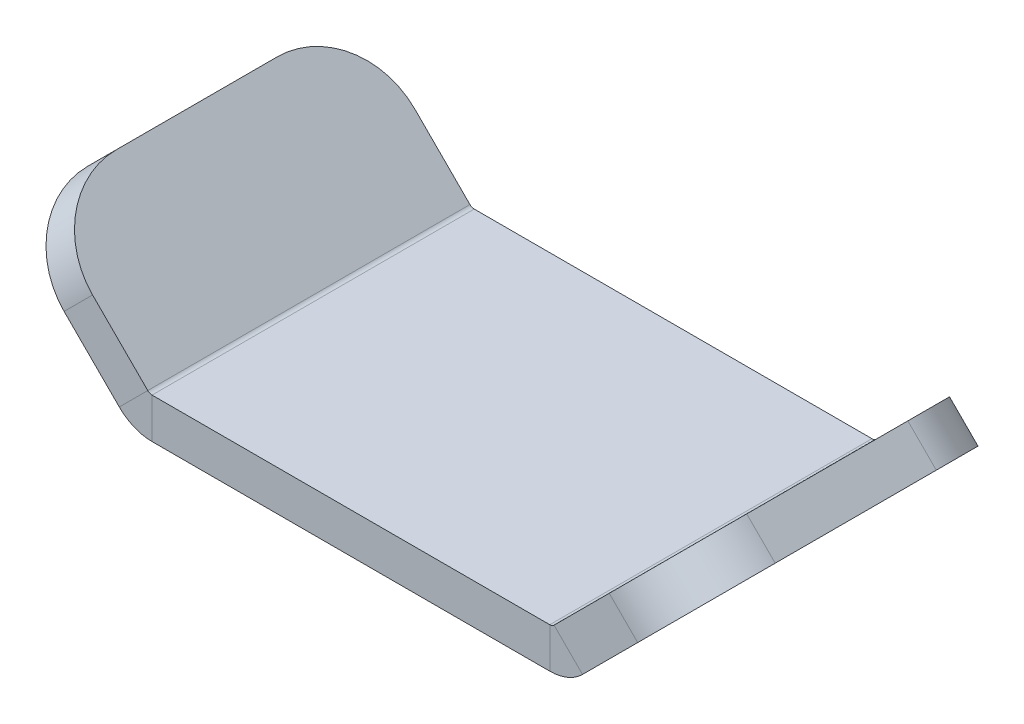
from build123d import *

# Parameters (mm, degrees)
SM_BASE_FLANGE_1_DEPTH = 20
FILLET_1_R             = 10


# Sheet-metal steps are written as plain solids
with BuildPart() as part:
    # Sketch 1 → Базовая кромка1 (new body)
    with BuildSketch(Plane.XY):
        with BuildLine():
            Line((39.142135624, 14.142135624), (25.219669914, 0.219669914))
            ThreePointArc((25.219669914, 0.219669914), (24.976352402, 0.057090351), (24.689339828, 0))
            Line((24.689339828, 0), (-24.689339828, 0))
            ThreePointArc((-24.689339828, 0), (-24.976352402, 0.057090351), (-25.219669914, 0.219669914))
            Line((-25.219669914, 0.219669914), (-39.142135624, 14.142135624))
            Line((-39.142135624, 14.142135624), (-42.67766953, 10.606601718))
            Line((-42.67766953, 10.606601718), (-28.75520382, -3.315863992))
            ThreePointArc((-28.75520382, -3.315863992), (-26.889769564, -4.562307312), (-24.689339828, -5))
            Line((-24.689339828, -5), (24.689339828, -5))
            ThreePointArc((24.689339828, -5), (26.889769564, -4.562307312), (28.75520382, -3.315863992))
            Line((28.75520382, -3.315863992), (42.67766953, 10.606601718))
            Line((42.67766953, 10.606601718), (39.142135624, 14.142135624))
        make_face()
    extrude(amount=SM_BASE_FLANGE_1_DEPTH)

    # Скругление1
    fillet_1_edges = [part.edges().sort_by_distance(p)[0] for p in [
        (40.909902577, 12.374368671, 20),
        (-40.909902577, 12.374368671, 20),
    ]]
    fillet(fillet_1_edges, radius=FILLET_1_R)

    # Зеркальное отражение1: part across plane


with BuildPart() as part_1:
    add(part.part)
    add(part.part.mirror(Plane(origin=(28.75520382, -3.315863992, 0), x_dir=(1, 0, 0), z_dir=(0, 0, -1))))


solid = part_1.part
